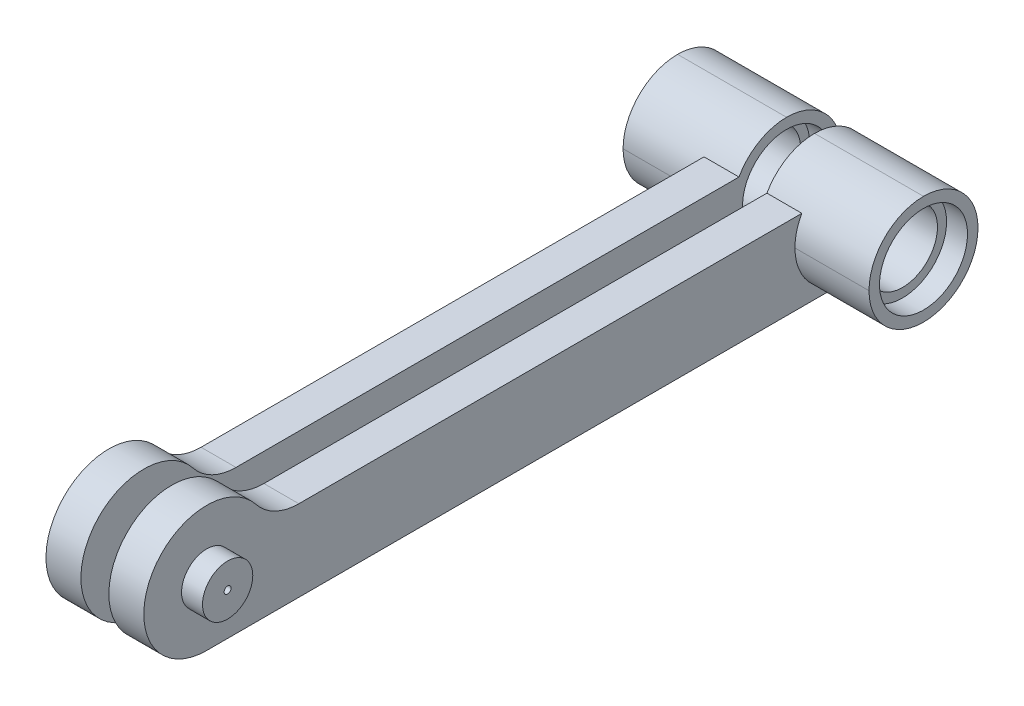
from build123d import *

# Parameters (mm, degrees)
SKETCH_1_R          = 4.5
SKETCH_1_W          = 49.9
SKETCH_1_H          = 7.8
EXTRUDE_1_DEPTH     = 2.5
EXTRUDE_START       = 2.5
SKETCH_1_6_R        = 1.8
SKETCH_1_6_R_2      = 0.25
EXTRUDE_3_DEPTH     = 1.5
SKETCH_1_5_W        = 7.8
SKETCH_1_5_H        = 7.8
EXTRUDE_2_DEPTH     = 7.8
SKETCH_1_7_R        = 2.5
CUT_EXTRUDE_1_DEPTH = 51.706015422
SKETCH_1_8_R        = 3.15
SKETCH_1_8_R_2      = 2.5
CUT_EXTRUDE_2_DEPTH = 1.5
CUT_EXTRUDE_START   = 6.3
SKETCH_1_9_R        = 3.15
SKETCH_1_9_R_2      = 2.5
CUT_EXTRUDE_3_DEPTH = 1.5
SKETCH_2_W          = 0.191868154
SKETCH_2_H          = 2
SKETCH_2_W_2        = 37.6
CUT_EXTRUDE_4_DEPTH = 51.706015422
FILLET_1_R          = 3.9


with BuildPart() as part:
    # 草图1 → 凸台-拉伸1 (new body)
    with BuildSketch(Plane(origin=(0, 0, 0), x_dir=(0, 0, -1), z_dir=(1, 0, 0))):
        Circle(SKETCH_1_R)
        with Locations((24.95, -0.6)):
            Rectangle(SKETCH_1_W, SKETCH_1_H)
    extrude(amount=EXTRUDE_1_DEPTH)

    # 草图1<6> → 凸台-拉伸3 (add)
    with BuildSketch(Plane(origin=(0, 0, 0), x_dir=(0, 0, -1), z_dir=(1, 0, 0)).offset(EXTRUDE_START)):
        Circle(SKETCH_1_6_R)
        Circle(SKETCH_1_6_R_2, mode=Mode.SUBTRACT)
    extrude(amount=EXTRUDE_3_DEPTH)

    # 草图1<5> → 凸台-拉伸2 (add)
    with BuildSketch(Plane(origin=(0, 0, 0), x_dir=(0, 0, -1), z_dir=(1, 0, 0))):
        with Locations((46, -0.6)):
            Rectangle(SKETCH_1_5_W, SKETCH_1_5_H)
    extrude(amount=EXTRUDE_2_DEPTH)

    # 草图1<7> → 切除-拉伸1 (cut, through all)
    with BuildSketch(Plane(origin=(0, 0, 0), x_dir=(0, 0, -1), z_dir=(1, 0, 0))):
        with Locations((46, -0.6)):
            Circle(SKETCH_1_7_R)
    extrude(amount=CUT_EXTRUDE_1_DEPTH, mode=Mode.SUBTRACT)

    # 草图1<8> → 切除-拉伸2 (cut)
    with BuildSketch(Plane(origin=(0, 0, 0), x_dir=(0, 0, -1), z_dir=(1, 0, 0))):
        with Locations((46, -0.6)):
            Circle(SKETCH_1_8_R)
        with Locations((46, -0.6)):
            Circle(SKETCH_1_8_R_2, mode=Mode.SUBTRACT)
    extrude(amount=CUT_EXTRUDE_2_DEPTH, mode=Mode.SUBTRACT)

    # 草图1<9> → 切除-拉伸3 (cut)
    with BuildSketch(Plane(origin=(0, 0, 0), x_dir=(0, 0, -1), z_dir=(1, 0, 0)).offset(CUT_EXTRUDE_START)):
        with Locations((46, -0.6)):
            Circle(SKETCH_1_9_R)
        with Locations((46, -0.6)):
            Circle(SKETCH_1_9_R_2, mode=Mode.SUBTRACT)
    extrude(amount=CUT_EXTRUDE_3_DEPTH, mode=Mode.SUBTRACT)

    # 草图2 → 切除-拉伸4 (cut, through all)
    with BuildSketch(Plane.ZY):
        with BuildLine():
            Line((-3.059411708, 3.3), (-4.308131846, 3.3))
            Line((-4.308131846, 3.3), (-4.308131846, 1.3))
            ThreePointArc((-4.308131846, 1.3), (-3.817089795, 2.383238447), (-3.059411708, 3.3))
        make_face()
        with Locations((-4.404065923, 2.3)):
            Rectangle(SKETCH_2_W, SKETCH_2_H)
        with Locations((-23.3, 2.3)):
            Rectangle(SKETCH_2_W_2, SKETCH_2_H)
    extrude(amount=-CUT_EXTRUDE_4_DEPTH, mode=Mode.SUBTRACT)

    # 圆角1
    fillet_1_edges = [part.edges().sort_by_distance(p)[0] for p in [
        (1.25, 1.3, -4.308131846),
    ]]
    fillet(fillet_1_edges, radius=FILLET_1_R)
    fillet_1_2_edges = [part.edges().sort_by_distance(p)[0] for p in [
        (3.9, -4.5, -49.9),
        (3.9, 3.3, -49.9),
        (5.15, -4.5, -42.1),
        (3.9, 3.3, -42.1),
    ]]
    fillet(fillet_1_2_edges, radius=FILLET_1_R - 0.0001)  # a hair under: the kernel refuses the full size


with BuildPart() as body_2:
    # 镜向2: mirrored copy
    add(part.part.mirror(Plane.ZY.offset(1)))


solid = Compound([part.part, body_2.part])
